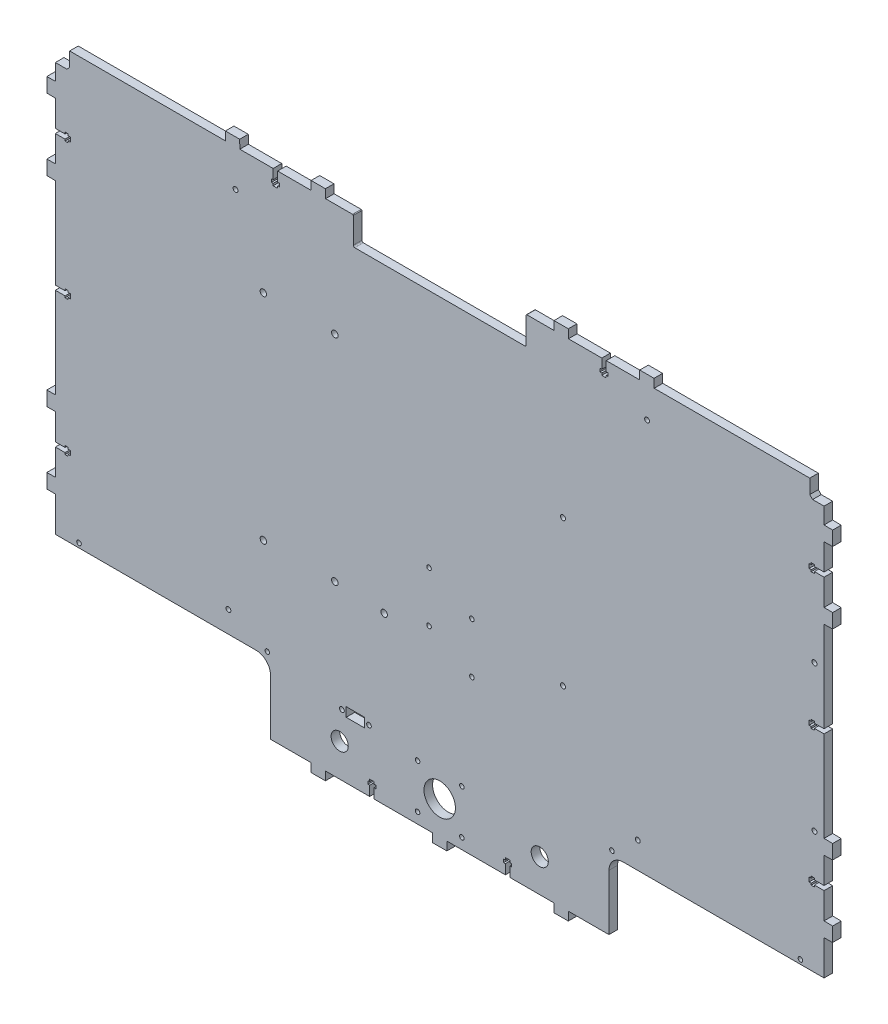
from build123d import *

# Parameters (mm, degrees)
SKETCH_1_R      = 1.6
SKETCH_1_R_2    = 1.7
SKETCH_1_R_3    = 6
SKETCH_1_W      = 13
SKETCH_1_H      = 6.5
SKETCH_1_R_4    = 1.626470027
SKETCH_1_R_5    = 2.25
SKETCH_1_R_6    = 11
SKETCH_1_R_7    = 1.75
EXTRUDE_1_DEPTH = 6


with BuildPart() as part:
    # Эскиз1 → Бобышка-Вытянуть1 (new body)
    with BuildSketch(Plane.XY):
        with BuildLine():
            Line((89.741925364, 540.592043616), (89.741925364, 501.687589553))
            Line((89.741925364, 501.687589553), (118.091925364, 501.687589553))
            Line((118.091925364, 501.687589553), (118.191925364, 495.687589553))
            Line((118.191925364, 495.687589553), (128.191925364, 495.687589553))
            Line((128.191925364, 495.687589553), (128.291925364, 501.687589553))
            Line((128.291925364, 501.687589553), (159.141925364, 501.687589553))
            Line((159.141925364, 501.687589553), (159.141925364, 508.487589553))
            Line((159.141925364, 508.487589553), (157.941925364, 508.487589553))
            Line((157.941925364, 508.487589553), (157.941925364, 510.687589553))
            Line((157.941925364, 510.687589553), (159.141925364, 510.687589553))
            Line((159.141925364, 510.687589553), (159.141925364, 512.187589553))
            Line((159.141925364, 512.187589553), (162.241925364, 512.187589553))
            Line((162.241925364, 512.187589553), (162.241925364, 510.687589553))
            Line((162.241925364, 510.687589553), (163.441925364, 510.687589553))
            Line((163.441925364, 510.687589553), (163.441925364, 508.487589553))
            Line((163.441925364, 508.487589553), (162.241925364, 508.487589553))
            Line((162.241925364, 508.487589553), (162.241925364, 501.687589553))
            Line((162.241925364, 501.687589553), (203.091925364, 501.687589553))
            Line((203.091925364, 501.687589553), (203.191925364, 495.687589553))
            Line((203.191925364, 495.687589553), (213.191925364, 495.687589553))
            Line((213.191925364, 495.687589553), (213.291925364, 501.687589553))
            Line((213.291925364, 501.687589553), (254.141925364, 501.687589553))
            Line((254.141925364, 501.687589553), (254.141925364, 508.487589553))
            Line((254.141925364, 508.487589553), (252.941925364, 508.487589553))
            Line((252.941925364, 508.487589553), (252.941925364, 510.687589553))
            Line((252.941925364, 510.687589553), (254.141925364, 510.687589553))
            Line((254.141925364, 510.687589553), (254.141925364, 512.187589553))
            Line((254.141925364, 512.187589553), (257.241925364, 512.187589553))
            Line((257.241925364, 512.187589553), (257.241925364, 510.687589553))
            Line((257.241925364, 510.687589553), (258.441925364, 510.687589553))
            Line((258.441925364, 510.687589553), (258.441925364, 508.487589553))
            Line((258.441925364, 508.487589553), (257.241925364, 508.487589553))
            Line((257.241925364, 508.487589553), (257.241925364, 501.687589553))
            Line((257.241925364, 501.687589553), (288.091925364, 501.687589553))
            Line((288.091925364, 501.687589553), (288.191925364, 495.687589553))
            Line((288.191925364, 495.687589553), (298.191925364, 495.687589553))
            Line((298.191925364, 495.687589553), (298.291925364, 501.687589553))
            Line((298.291925364, 501.687589553), (326.641925364, 501.687589553))
            Line((326.641925364, 501.687589553), (326.641925364, 540.687589553))
            ThreePointArc((326.641925364, 540.687589553), (329.570857552, 547.758657365), (336.641925364, 550.687589553))
            Line((336.641925364, 550.687589553), (377.191925364, 550.687589553))
            Line((377.191925364, 550.687589553), (477.191925364, 550.687589553))
            Line((477.191925364, 550.687589553), (477.191925364, 575.087589553))
            Line((477.191925364, 575.087589553), (483.191925364, 575.187589553))
            Line((483.191925364, 575.187589553), (483.191925364, 585.187589553))
            Line((483.191925364, 585.187589553), (477.191925364, 585.287589553))
            Line((477.191925364, 585.287589553), (477.191925364, 603.637589553))
            Line((477.191925364, 603.637589553), (470.391925364, 603.637589553))
            Line((470.391925364, 603.637589553), (470.391925364, 602.437589553))
            Line((470.391925364, 602.437589553), (468.191925364, 602.437589553))
            Line((468.191925364, 602.437589553), (468.191925364, 603.637589553))
            Line((468.191925364, 603.637589553), (466.691925364, 603.637589553))
            Line((466.691925364, 603.637589553), (466.691925364, 606.737589553))
            Line((466.691925364, 606.737589553), (468.191925364, 606.737589553))
            Line((468.191925364, 606.737589553), (468.191925364, 607.937589553))
            Line((468.191925364, 607.937589553), (470.391925364, 607.937589553))
            Line((470.391925364, 607.937589553), (470.391925364, 606.737589553))
            Line((470.391925364, 606.737589553), (477.191925364, 606.737589553))
            Line((477.191925364, 606.737589553), (477.191925364, 625.087589553))
            Line((477.191925364, 625.087589553), (483.191925364, 625.187589553))
            Line((483.191925364, 625.187589553), (483.191925364, 635.187589553))
            Line((483.191925364, 635.187589553), (477.191925364, 635.287589553))
            Line((477.191925364, 635.287589553), (477.191925364, 698.637589553))
            Line((477.191925364, 698.637589553), (470.391925364, 698.637589553))
            Line((470.391925364, 698.637589553), (470.391925364, 697.437589553))
            Line((470.391925364, 697.437589553), (468.191925364, 697.437589553))
            Line((468.191925364, 697.437589553), (468.191925364, 698.637589553))
            Line((468.191925364, 698.637589553), (466.691925364, 698.637589553))
            Line((466.691925364, 698.637589553), (466.691925364, 701.737589553))
            Line((466.691925364, 701.737589553), (468.191925364, 701.737589553))
            Line((468.191925364, 701.737589553), (468.191925364, 702.937589553))
            Line((468.191925364, 702.937589553), (470.391925364, 702.937589553))
            Line((470.391925364, 702.937589553), (470.391925364, 701.737589553))
            Line((470.391925364, 701.737589553), (477.191925364, 701.737589553))
            Line((477.191925364, 701.737589553), (477.191925364, 765.087589553))
            Line((477.191925364, 765.087589553), (483.191925364, 765.187589553))
            Line((483.191925364, 765.187589553), (483.191925364, 775.187589553))
            Line((483.191925364, 775.187589553), (477.191925364, 775.287589553))
            Line((477.191925364, 775.287589553), (477.191925364, 793.637589553))
            Line((477.191925364, 793.637589553), (470.391925364, 793.637589553))
            Line((470.391925364, 793.637589553), (470.391925364, 792.437589553))
            Line((470.391925364, 792.437589553), (468.191925364, 792.437589553))
            Line((468.191925364, 792.437589553), (468.191925364, 793.637589553))
            Line((468.191925364, 793.637589553), (466.691925364, 793.637589553))
            Line((466.691925364, 793.637589553), (466.691925364, 796.737589553))
            Line((466.691925364, 796.737589553), (468.191925364, 796.737589553))
            Line((468.191925364, 796.737589553), (468.191925364, 797.937589553))
            Line((468.191925364, 797.937589553), (470.391925364, 797.937589553))
            Line((470.391925364, 797.937589553), (470.391925364, 796.737589553))
            Line((470.391925364, 796.737589553), (477.191925364, 796.737589553))
            Line((477.191925364, 796.737589553), (477.191925364, 815.087589553))
            Line((477.191925364, 815.087589553), (483.191925364, 815.187589553))
            Line((483.191925364, 815.187589553), (483.191925364, 825.187589553))
            Line((483.191925364, 825.187589553), (477.191925364, 825.287589553))
            Line((477.191925364, 825.287589553), (477.191925364, 836.687589553))
            Line((477.191925364, 836.687589553), (469.191925364, 836.687589553))
            Line((469.191925364, 836.687589553), (467.191925364, 838.687589553))
            Line((467.191925364, 838.687589553), (467.191925364, 848.687589553))
            Line((467.191925364, 848.687589553), (367.191925364, 848.687589553))
            Line((367.191925364, 848.687589553), (358.291925364, 848.687589553))
            Line((358.291925364, 848.687589553), (358.191925364, 854.687589553))
            Line((358.191925364, 854.687589553), (348.191925364, 854.687589553))
            Line((348.191925364, 854.687589553), (348.091925364, 848.687589553))
            Line((348.091925364, 848.687589553), (324.741925364, 848.687589553))
            Line((324.741925364, 848.687589553), (324.741925364, 841.887589553))
            Line((324.741925364, 841.887589553), (325.941925364, 841.887589553))
            Line((325.941925364, 841.887589553), (325.941925364, 839.687589553))
            Line((325.941925364, 839.687589553), (324.741925364, 839.687589553))
            Line((324.741925364, 839.687589553), (324.741925364, 838.187589553))
            Line((324.741925364, 838.187589553), (321.641925364, 838.187589553))
            Line((321.641925364, 838.187589553), (321.641925364, 839.687589553))
            Line((321.641925364, 839.687589553), (320.441925364, 839.687589553))
            Line((320.441925364, 839.687589553), (320.441925364, 841.887589553))
            Line((320.441925364, 841.887589553), (321.641925364, 841.887589553))
            Line((321.641925364, 841.887589553), (321.641925364, 848.687589553))
            Line((321.641925364, 848.687589553), (298.291925364, 848.687589553))
            Line((298.291925364, 848.687589553), (298.191925364, 854.687589553))
            Line((298.191925364, 854.687589553), (288.191925364, 854.687589553))
            Line((288.191925364, 854.687589553), (288.091925364, 848.687589553))
            Line((288.091925364, 848.687589553), (269.191925364, 848.687589553))
            ThreePointArc((269.191925364, 848.687589553), (268.838371974, 848.541142943), (268.691925364, 848.187589553))
            Line((268.691925364, 848.187589553), (268.691925364, 830.092043616))
            ThreePointArc((268.691925364, 830.092043616), (268.399032145, 829.384936835), (267.691925364, 829.092043616))
            Line((267.691925364, 829.092043616), (148.691925364, 829.092043616))
            ThreePointArc((148.691925364, 829.092043616), (147.984818583, 829.384936835), (147.691925364, 830.092043616))
            Line((147.691925364, 830.092043616), (147.691925364, 848.092043616))
            ThreePointArc((147.691925364, 848.092043616), (147.545478755, 848.445597007), (147.191925364, 848.592043616))
            Line((147.191925364, 848.592043616), (128.291925364, 848.592043616))
            Line((128.291925364, 848.592043616), (128.191925364, 854.592043616))
            Line((128.191925364, 854.592043616), (118.191925364, 854.592043616))
            Line((118.191925364, 854.592043616), (118.091925364, 848.592043616))
            Line((118.091925364, 848.592043616), (94.741925364, 848.592043616))
            Line((94.741925364, 848.592043616), (94.741925364, 841.792043616))
            Line((94.741925364, 841.792043616), (95.941925364, 841.792043616))
            Line((95.941925364, 841.792043616), (95.941925364, 839.592043616))
            Line((95.941925364, 839.592043616), (94.741925364, 839.592043616))
            Line((94.741925364, 839.592043616), (94.741925364, 838.092043616))
            Line((94.741925364, 838.092043616), (91.641925364, 838.092043616))
            Line((91.641925364, 838.092043616), (91.641925364, 839.592043616))
            Line((91.641925364, 839.592043616), (90.441925364, 839.592043616))
            Line((90.441925364, 839.592043616), (90.441925364, 841.792043616))
            Line((90.441925364, 841.792043616), (91.641925364, 841.792043616))
            Line((91.641925364, 841.792043616), (91.641925364, 848.592043616))
            Line((91.641925364, 848.592043616), (68.291925364, 848.592043616))
            Line((68.291925364, 848.592043616), (68.191925364, 854.592043616))
            Line((68.191925364, 854.592043616), (58.191925364, 854.592043616))
            Line((58.191925364, 854.592043616), (58.091925364, 848.592043616))
            Line((58.091925364, 848.592043616), (49.191925364, 848.592043616))
            Line((49.191925364, 848.592043616), (-50.808074636, 848.592043616))
            Line((-50.808074636, 848.592043616), (-50.808074636, 838.592043616))
            Line((-50.808074636, 838.592043616), (-52.808074636, 836.592043616))
            Line((-52.808074636, 836.592043616), (-60.808074636, 836.592043616))
            Line((-60.808074636, 836.592043616), (-60.808074636, 825.192043616))
            Line((-60.808074636, 825.192043616), (-66.808074636, 825.092043616))
            Line((-66.808074636, 825.092043616), (-66.808074636, 815.092043616))
            Line((-66.808074636, 815.092043616), (-60.808074636, 814.992043616))
            Line((-60.808074636, 814.992043616), (-60.808074636, 796.642043616))
            Line((-60.808074636, 796.642043616), (-54.008074636, 796.642043616))
            Line((-54.008074636, 796.642043616), (-54.008074636, 797.842043616))
            Line((-54.008074636, 797.842043616), (-51.808074636, 797.842043616))
            Line((-51.808074636, 797.842043616), (-51.808074636, 796.642043616))
            Line((-51.808074636, 796.642043616), (-50.308074636, 796.642043616))
            Line((-50.308074636, 796.642043616), (-50.308074636, 793.542043616))
            Line((-50.308074636, 793.542043616), (-51.808074636, 793.542043616))
            Line((-51.808074636, 793.542043616), (-51.808074636, 792.342043616))
            Line((-51.808074636, 792.342043616), (-54.008074636, 792.342043616))
            Line((-54.008074636, 792.342043616), (-54.008074636, 793.542043616))
            Line((-54.008074636, 793.542043616), (-60.808074636, 793.542043616))
            Line((-60.808074636, 793.542043616), (-60.808074636, 775.192043616))
            Line((-60.808074636, 775.192043616), (-66.808074636, 775.092043616))
            Line((-66.808074636, 775.092043616), (-66.808074636, 765.092043616))
            Line((-66.808074636, 765.092043616), (-60.808074636, 764.992043616))
            Line((-60.808074636, 764.992043616), (-60.808074636, 701.642043616))
            Line((-60.808074636, 701.642043616), (-54.008074636, 701.642043616))
            Line((-54.008074636, 701.642043616), (-54.008074636, 702.842043616))
            Line((-54.008074636, 702.842043616), (-51.808074636, 702.842043616))
            Line((-51.808074636, 702.842043616), (-51.808074636, 701.642043616))
            Line((-51.808074636, 701.642043616), (-50.308074636, 701.642043616))
            Line((-50.308074636, 701.642043616), (-50.308074636, 698.542043616))
            Line((-50.308074636, 698.542043616), (-51.808074636, 698.542043616))
            Line((-51.808074636, 698.542043616), (-51.808074636, 697.342043616))
            Line((-51.808074636, 697.342043616), (-54.008074636, 697.342043616))
            Line((-54.008074636, 697.342043616), (-54.008074636, 698.542043616))
            Line((-54.008074636, 698.542043616), (-60.808074636, 698.542043616))
            Line((-60.808074636, 698.542043616), (-60.808074636, 635.192043616))
            Line((-60.808074636, 635.192043616), (-66.808074636, 635.092043616))
            Line((-66.808074636, 635.092043616), (-66.808074636, 625.092043616))
            Line((-66.808074636, 625.092043616), (-60.808074636, 624.992043616))
            Line((-60.808074636, 624.992043616), (-60.808074636, 606.642043616))
            Line((-60.808074636, 606.642043616), (-54.008074636, 606.642043616))
            Line((-54.008074636, 606.642043616), (-54.008074636, 607.842043616))
            Line((-54.008074636, 607.842043616), (-51.808074636, 607.842043616))
            Line((-51.808074636, 607.842043616), (-51.808074636, 606.642043616))
            Line((-51.808074636, 606.642043616), (-50.308074636, 606.642043616))
            Line((-50.308074636, 606.642043616), (-50.308074636, 603.542043616))
            Line((-50.308074636, 603.542043616), (-51.808074636, 603.542043616))
            Line((-51.808074636, 603.542043616), (-51.808074636, 602.342043616))
            Line((-51.808074636, 602.342043616), (-54.008074636, 602.342043616))
            Line((-54.008074636, 602.342043616), (-54.008074636, 603.542043616))
            Line((-54.008074636, 603.542043616), (-60.808074636, 603.542043616))
            Line((-60.808074636, 603.542043616), (-60.808074636, 585.192043616))
            Line((-60.808074636, 585.192043616), (-66.808074636, 585.092043616))
            Line((-66.808074636, 585.092043616), (-66.808074636, 575.092043616))
            Line((-66.808074636, 575.092043616), (-60.808074636, 574.992043616))
            Line((-60.808074636, 574.992043616), (-60.808074636, 550.592043616))
            Line((-60.808074636, 550.592043616), (39.191925364, 550.592043616))
            Line((39.191925364, 550.592043616), (79.741925364, 550.592043616))
            ThreePointArc((79.741925364, 550.592043616), (86.812993176, 547.663111428), (89.741925364, 540.592043616))
        make_face()
        with Locations((-44.258074636, 553.687589553)):
            Circle(SKETCH_1_R, mode=Mode.SUBTRACT)
        with Locations((60.306923435, 565.643369962)):
            Circle(SKETCH_1_R_2, mode=Mode.SUBTRACT)
        with Locations((138.191925364, 524.687589553)):
            Circle(SKETCH_1_R_3, mode=Mode.SUBTRACT)
        with Locations((192.691925364, 509.187589553)):
            Circle(SKETCH_1_R, mode=Mode.SUBTRACT)
        with Locations((192.691925364, 540.187589553)):
            Circle(SKETCH_1_R, mode=Mode.SUBTRACT)
        with Locations((87.541925364, 553.687589553)):
            Circle(SKETCH_1_R, mode=Mode.SUBTRACT)
        with Locations((139.700153258, 544.697548211)):
            Circle(SKETCH_1_R_2, mode=Mode.SUBTRACT)
        with Locations((149.200153258, 544.697548211)):
            Rectangle(SKETCH_1_W, SKETCH_1_H, mode=Mode.SUBTRACT)
        with Locations((158.700153258, 544.697548211)):
            Circle(SKETCH_1_R_4, mode=Mode.SUBTRACT)
        with Locations((84.78568386, 619.788752578)):
            Circle(SKETCH_1_R_5, mode=Mode.SUBTRACT)
        with Locations((134.78568386, 619.788752578)):
            Circle(SKETCH_1_R_5, mode=Mode.SUBTRACT)
        with Locations((169.28568386, 617.788752578)):
            Circle(SKETCH_1_R_5, mode=Mode.SUBTRACT)
        with Locations((200.717653837, 625.897847132)):
            Circle(SKETCH_1_R, mode=Mode.SUBTRACT)
        with Locations((200.717653837, 661.157846204)):
            Circle(SKETCH_1_R, mode=Mode.SUBTRACT)
        with Locations((223.691925364, 509.187589553)):
            Circle(SKETCH_1_R, mode=Mode.SUBTRACT)
        with Locations((208.191925364, 524.687589553)):
            Circle(SKETCH_1_R_6, mode=Mode.SUBTRACT)
        with Locations((223.691925364, 540.187589553)):
            Circle(SKETCH_1_R, mode=Mode.SUBTRACT)
        with Locations((278.191925364, 524.687589553)):
            Circle(SKETCH_1_R_3, mode=Mode.SUBTRACT)
        with Locations((328.741925364, 553.687589553)):
            Circle(SKETCH_1_R, mode=Mode.SUBTRACT)
        with Locations((346.784706522, 569.071596444)):
            Circle(SKETCH_1_R_2, mode=Mode.SUBTRACT)
        with Locations((460.641925364, 553.687589553)):
            Circle(SKETCH_1_R, mode=Mode.SUBTRACT)
        with Locations((230.717653837, 609.897847132)):
            Circle(SKETCH_1_R, mode=Mode.SUBTRACT)
        with Locations((230.717653837, 645.157846204)):
            Circle(SKETCH_1_R, mode=Mode.SUBTRACT)
        with Locations((294.485262853, 636.368280179)):
            Circle(SKETCH_1_R_7, mode=Mode.SUBTRACT)
        with Locations((470.485262853, 636.368280179)):
            Circle(SKETCH_1_R_7, mode=Mode.SUBTRACT)
        with Locations((65.280069026, 822.688709986)):
            Circle(SKETCH_1_R_2, mode=Mode.SUBTRACT)
        with Locations((84.78568386, 769.788752578)):
            Circle(SKETCH_1_R_5, mode=Mode.SUBTRACT)
        with Locations((134.78568386, 769.788752578)):
            Circle(SKETCH_1_R_5, mode=Mode.SUBTRACT)
        with Locations((294.485262853, 738.368280179)):
            Circle(SKETCH_1_R_7, mode=Mode.SUBTRACT)
        with Locations((470.485262853, 738.368280179)):
            Circle(SKETCH_1_R_7, mode=Mode.SUBTRACT)
        with Locations((353.343052835, 826.939418984)):
            Circle(SKETCH_1_R_2, mode=Mode.SUBTRACT)
    extrude(amount=EXTRUDE_1_DEPTH)


solid = part.part
